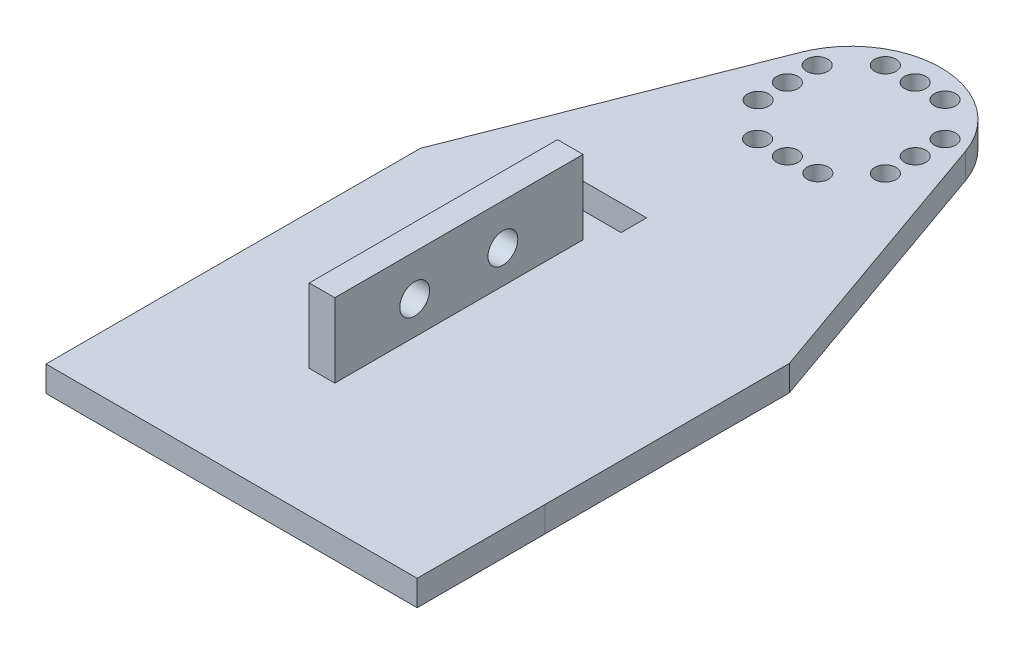
from build123d import *

# Parameters (mm, degrees)
SKETCH2_R           = 1.25
BOSS_EXTRUDE1_DEPTH = 3
SKETCH6_W           = 3
SKETCH6_H           = 29.12999922
BOSS_EXTRUDE3_DEPTH = 11.68
SKETCH9_R           = 1.75
CUT_EXTRUDE2_DEPTH  = 5
BOSS_EXTRUDE4_DEPTH = 15
SKETCH11_W          = 8
SKETCH11_H          = 3
CUT_EXTRUDE4_DEPTH  = 10


with BuildPart() as part:
    # Sketch2 → Boss-Extrude1 (new body)
    with BuildSketch(Plane(origin=(0, 0, 0), x_dir=(1, 0, 0), z_dir=(0, 1, 0))):
        with BuildLine():
            ThreePointArc((9.924191255, 3.512841719), (0, 10.527565199), (-9.924191255, 3.512841719))
            Line((-9.924191255, 3.512841719), (-22.339897891, -28.212185032))
            Line((-22.339897891, -28.212185032), (-22.388445596, -57.094438481))
            Line((-22.388445596, -57.094438481), (21.162477615, -57.094438481))
            Line((21.162477615, -57.094438481), (21.162544036, -28.414715022))
            Line((21.162544036, -28.414715022), (9.924191255, 3.512841719))
        make_face()
        with Locations((-3.499861001, -7.487216855)):
            Circle(SKETCH2_R, mode=Mode.SUBTRACT)
        with Locations((-7.42819985, -3.486548919)):
            Circle(SKETCH2_R, mode=Mode.SUBTRACT)
        with Locations((-7.499989222, 0.012714758)):
            Circle(SKETCH2_R, mode=Mode.SUBTRACT)
        with Locations((-7.500049059, 3.512714758)):
            Circle(SKETCH2_R, mode=Mode.SUBTRACT)
        with Locations((-3.500117445, 7.512783142)):
            Circle(SKETCH2_R, mode=Mode.SUBTRACT)
        with Locations((0.000138999, -7.487157018)):
            Circle(SKETCH2_R, mode=Mode.SUBTRACT)
        with Locations((3.499402676, -7.415367646)):
            Circle(SKETCH2_R, mode=Mode.SUBTRACT)
        with Locations((7.500070612, -3.487028797)):
            Circle(SKETCH2_R, mode=Mode.SUBTRACT)
        with Locations((7.500010775, 0.012971203)):
            Circle(SKETCH2_R, mode=Mode.SUBTRACT)
        with Locations((-0.000117446, 7.512842979)):
            Circle(SKETCH2_R, mode=Mode.SUBTRACT)
        with Locations((3.499882554, 7.512902816)):
            Circle(SKETCH2_R, mode=Mode.SUBTRACT)
        with Locations((7.500070612, 3.512971202)):
            Circle(SKETCH2_R, mode=Mode.SUBTRACT)
    extrude(amount=-BOSS_EXTRUDE1_DEPTH)

    # Sketch6 → Boss-Extrude3 (add)
    with BuildSketch(Plane.XZ.offset(3)):
        with Locations((-5, 42.529438871)):
            Rectangle(SKETCH6_W, SKETCH6_H)
    extrude(amount=-BOSS_EXTRUDE3_DEPTH)

    # Sketch9 → Cut-Extrude2 (cut)
    with BuildSketch(Plane(origin=(-3.5, 0, 0), x_dir=(0, 0, -1), z_dir=(1, 0, 0))):
        with Locations((-37.369439261, 3.88)):
            Circle(SKETCH9_R)
        with Locations((-47.719439261, 3.88)):
            Circle(SKETCH9_R)
    extrude(amount=-CUT_EXTRUDE2_DEPTH, mode=Mode.SUBTRACT)

    # Sketch10 → Boss-Extrude4 (add)
    with BuildSketch(Plane.XY.offset(57.094438481)):
        Polygon((-22.388445596, 0), (-6.5, 0), (-3.5, 0), (21.162477615, 0), (21.162477615, -3), (-22.388445596, -3), align=None)
    extrude(amount=BOSS_EXTRUDE4_DEPTH)

    # Sketch11 → Cut-Extrude4 (cut)
    with BuildSketch(Plane(origin=(0, 0, 0), x_dir=(1, 0, 0), z_dir=(0, 1, 0))):
        with Locations((-6, -23.5)):
            Rectangle(SKETCH11_W, SKETCH11_H)
    extrude(amount=-CUT_EXTRUDE4_DEPTH, mode=Mode.SUBTRACT)


solid = part.part
